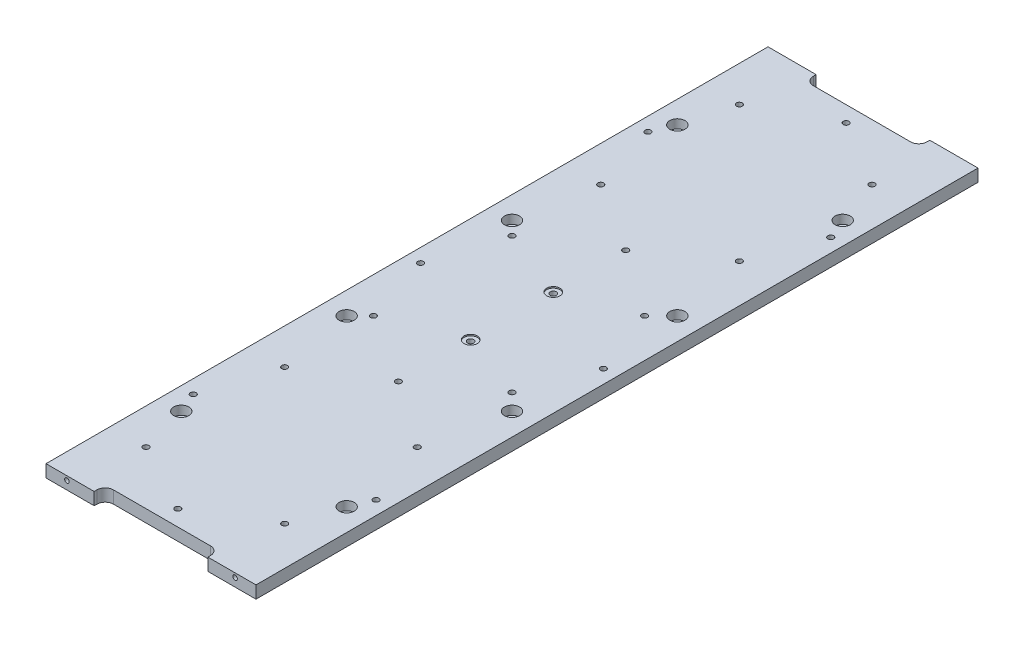
from build123d import *

# Parameters (mm, degrees)
BOSS_EXTRUDE1_DEPTH                                 = 6
CBORE_FOR_M4_HEX_SOCKET_HEAD_CAP_SCREW1_D           = 4.5
CBORE_FOR_M4_HEX_SOCKET_HEAD_CAP_SCREW1_CBORE_D     = 8
CBORE_FOR_M4_HEX_SOCKET_HEAD_CAP_SCREW1_CBORE_DEPTH = 4.4
CBORE_START                                         = 7.6
CBORE_FOR_M4_HEX_SOCKET_HEAD_CAP_SCR_2_R            = 4
CBORE_FOR_M4_HEX_SOCKET_HEAD_CAP_SCREW2_DEPTH       = 4.4
CBORE_START_2                                       = 1
CBORE_FOR_M4_HEX_SOCKET_HEAD_CAP_SCR_3_O_R          = 2.25
CBORE_FOR_M4_HEX_SOCKET_HEAD_CAP_SCR_3_DEPTH        = 6.6
SKETCH15_W                                          = 81.5
SKETCH15_H                                          = 12
BOSS_EXTRUDE2_DEPTH                                 = 2
M4_TAPPED_HOLE1_D                                   = 3.3
CUT_EXTRUDE1_DEPTH                                  = 70.296464556
CUT_EXTRUDE3_DEPTH                                  = 70.296464574
FILLET1_R                                           = 4
SKETCH16_W                                          = 20
SKETCH16_H                                          = 12
BOSS_EXTRUDE3_DEPTH                                 = 2.75
FILLET2_R                                           = 3.5
M2_TAPPED_HOLE1_D                                   = 1.6
M2_TAPPED_HOLE1_DEPTH                               = 7.2
M2_TAPPED_HOLE1_TIP                                 = 0.480688495
M3_TAPPED_HOLE1_D                                   = 2.5
BOSS_EXTRUDE4_DEPTH                                 = 9
M4_TAPPED_HOLE2_AT_2_COUNT                          = 2
M4_TAPPED_HOLE2_AT_2_PITCH                          = 122
CBORE_FOR_M6_HEX_SOCKET_HEAD_CAP_SCREW1_D           = 6.6
CBORE_FOR_M6_HEX_SOCKET_HEAD_CAP_SCREW1_CBORE_D     = 11
CBORE_FOR_M6_HEX_SOCKET_HEAD_CAP_SCREW1_CBORE_DEPTH = 6.4
SKETCH44_R                                          = 4.826
CUT_EXTRUDE6_DEPTH                                  = 1
CBORE_FOR_M4_HEX_SOCKET_HEAD_CAP_SCREW3_D           = 4.5
CBORE_FOR_M4_HEX_SOCKET_HEAD_CAP_SCREW3_CBORE_D     = 8
CBORE_FOR_M4_HEX_SOCKET_HEAD_CAP_SCREW3_CBORE_DEPTH = 4.4
M5_TAPPED_HOLE1_D                                   = 4.2


# Read off the part's stored shape, not the designer's step: CBORE for M4 Hex Socket Head Cap Screw2
with BuildPart() as part:
    # Sketch2 → Boss-Extrude1 (new, symmetric)
    with BuildSketch(Plane(origin=(0, 0, 0), x_dir=(1, 0, 0), z_dir=(0, 1, 0))):
        with BuildLine():
            Line((67, 11), (67, -10.5))
            ThreePointArc((67, -10.5), (66.560660172, -11.560660172), (65.5, -12))
            Line((65.5, -12), (-65.5, -12))
            ThreePointArc((-65.5, -12), (-66.560660172, -11.560660172), (-67, -10.5))
            Line((-67, -10.5), (-67, 11))
            Line((-67, 11), (0, 11))
            Line((0, 11), (67, 11))
        make_face()
        with BuildLine():
            Line((42.806252715, 3.5), (35.85, 3.5))
            ThreePointArc((35.85, 3.5), (34.435786438, 4.085786438), (33.85, 5.5))
            Line((33.85, 5.5), (33.85, 8.25))
            ThreePointArc((33.85, 8.25), (33.190990258, 9.840990258), (31.6, 10.5))
            Line((31.6, 10.5), (19.6, 10.5))
            ThreePointArc((19.6, 10.5), (17.35, 8.25), (19.6, 6))
            Line((19.6, 6), (27.75, 6))
            ThreePointArc((27.75, 6), (29.164213562, 5.414213562), (29.75, 4))
            Line((29.75, 4), (29.75, 1.25))
            ThreePointArc((29.75, 1.25), (30.409009742, -0.340990258), (32, -1))
            Line((32, -1), (42.062746067, -1))
            ThreePointArc((42.062746067, -1), (57.892990527, -1.304109096), (42.806252715, 3.5))
        make_face(mode=Mode.SUBTRACT)
        with BuildLine():
            Line((-42.062746067, -1), (-32, -1))
            ThreePointArc((-32, -1), (-30.409009742, -0.340990258), (-29.75, 1.25))
            Line((-29.75, 1.25), (-29.75, 4))
            ThreePointArc((-29.75, 4), (-29.164213562, 5.414213562), (-27.75, 6))
            Line((-27.75, 6), (-19.6, 6))
            ThreePointArc((-19.6, 6), (-17.35, 8.25), (-19.6, 10.5))
            Line((-19.6, 10.5), (-31.6, 10.5))
            ThreePointArc((-31.6, 10.5), (-33.190990258, 9.840990258), (-33.85, 8.25))
            Line((-33.85, 8.25), (-33.85, 5.5))
            ThreePointArc((-33.85, 5.5), (-34.435786438, 4.085786438), (-35.85, 3.5))
            Line((-35.85, 3.5), (-42.806252715, 3.5))
            ThreePointArc((-42.806252715, 3.5), (-57.892990527, -1.304109096), (-42.062746067, -1))
        make_face(mode=Mode.SUBTRACT)
    extrude(amount=BOSS_EXTRUDE1_DEPTH, both=True)

    # CBORE for M4 Hex Socket Head Cap Screw1 (through all)
    with Locations(Plane.XY.offset(12)):
        with Locations((61, 0), (-61, 0)):
            CounterBoreHole(CBORE_FOR_M4_HEX_SOCKET_HEAD_CAP_SCREW1_D / 2, CBORE_FOR_M4_HEX_SOCKET_HEAD_CAP_SCREW1_CBORE_D / 2, CBORE_FOR_M4_HEX_SOCKET_HEAD_CAP_SCREW1_CBORE_DEPTH)

    # CBORE for M4 Hex Socket Head Cap Scr 2 → CBORE for M4 Hex Socket Head Cap Screw2 (cut)
    with BuildSketch(Plane.XY.offset(CBORE_START)):
        with Locations((-38, 0)):
            Circle(CBORE_FOR_M4_HEX_SOCKET_HEAD_CAP_SCR_2_R)
        with Locations((38, 0)):
            Circle(CBORE_FOR_M4_HEX_SOCKET_HEAD_CAP_SCR_2_R)
    extrude(amount=CBORE_FOR_M4_HEX_SOCKET_HEAD_CAP_SCREW2_DEPTH, mode=Mode.SUBTRACT)

    # CBORE for M4 Hex Socket Head Cap Scr 3 o → CBORE for M4 Hex Socket Head Cap Scr 3 (cut)
    with BuildSketch(Plane.XY.offset(CBORE_START_2)):
        with Locations((-38, 0)):
            Circle(CBORE_FOR_M4_HEX_SOCKET_HEAD_CAP_SCR_3_O_R)
        with Locations((38, 0)):
            Circle(CBORE_FOR_M4_HEX_SOCKET_HEAD_CAP_SCR_3_O_R)
    extrude(amount=CBORE_FOR_M4_HEX_SOCKET_HEAD_CAP_SCR_3_DEPTH, mode=Mode.SUBTRACT)

    # Sketch15 → Boss-Extrude2 (add)
    with BuildSketch(Plane(origin=(0, 0, -11), x_dir=(-1, 0, 0), z_dir=(0, 0, -1))):
        Rectangle(SKETCH15_W, SKETCH15_H)
    extrude(amount=BOSS_EXTRUDE2_DEPTH)

    # M4 Tapped Hole1 (through all)
    with Locations(Plane.XY.offset(12)):
        with Locations((38, 0), (-38, 0)):
            Hole(M4_TAPPED_HOLE1_D / 2)

    # Sketch12 → Cut-Revolve1 (revolve, cut)
    with BuildSketch(Plane.XY, mode=Mode.PRIVATE) as cut_revolve1_sk:
        Polygon((0, -6), (6.5, -6), (6.5, -2), (5, -2), (5, 1.25), (4, 1.25), (4, 2), (6.5, 2), (6.5, 6), (0, 6), align=None)
    revolve(cut_revolve1_sk.sketch.rotate(Axis((0, 0, 0), (0, 1, 0)), 90), axis=Axis((0, 0, 0), (0, 1, 0)), mode=Mode.SUBTRACT)

    # Sketch13 → Cut-Extrude1 (cut, through all)
    with BuildSketch(Plane(origin=(0, 6, 0), x_dir=(1, 0, 0), z_dir=(0, 1, 0))):
        with BuildLine():
            Line((-30.884585901, -4), (-19.6, -4))
            ThreePointArc((-19.6, -4), (-18.009009742, -3.340990258), (-17.35, -1.75))
            Line((-17.35, -1.75), (-17.35, 8.25))
            ThreePointArc((-17.35, 8.25), (-18.009009742, 6.659009742), (-19.6, 6))
            Line((-19.6, 6), (-27.75, 6))
            ThreePointArc((-27.75, 6), (-29.164213562, 5.414213562), (-29.75, 4))
            Line((-29.75, 4), (-29.75, 1.25))
            ThreePointArc((-29.75, 1.25), (-30.409009742, -0.340990258), (-32, -1))
            Line((-32, -1), (-35.85, -1))
            ThreePointArc((-35.85, -1), (-34.582145215, -1.281076639), (-33.551866671, -2.071637171))
            Line((-33.551866671, -2.071637171), (-32.608185898, -3.196272122))
            ThreePointArc((-32.608185898, -3.196272122), (-31.83547699, -3.789192521), (-30.884585901, -4))
        make_face()
        with BuildLine():
            Line((27.75, 6), (19.6, 6))
            ThreePointArc((19.6, 6), (18.009009742, 6.659009742), (17.35, 8.25))
            Line((17.35, 8.25), (17.35, -1.75))
            ThreePointArc((17.35, -1.75), (18.009009742, -3.340990258), (19.6, -4))
            Line((19.6, -4), (30.884585901, -4))
            ThreePointArc((30.884585901, -4), (31.83547699, -3.789192521), (32.608185898, -3.196272122))
            Line((32.608185898, -3.196272122), (33.551866671, -2.071637171))
            ThreePointArc((33.551866671, -2.071637171), (34.582145215, -1.281076639), (35.85, -1))
            Line((35.85, -1), (32, -1))
            ThreePointArc((32, -1), (30.409009742, -0.340990258), (29.75, 1.25))
            Line((29.75, 1.25), (29.75, 4))
            ThreePointArc((29.75, 4), (29.164213562, 5.414213562), (27.75, 6))
        make_face()
    extrude(amount=-CUT_EXTRUDE1_DEPTH, mode=Mode.SUBTRACT)

    # Sketch20 → Cut-Extrude3 (cut, through all)
    with BuildSketch(Plane(origin=(0, 6, 0), x_dir=(1, 0, 0), z_dir=(0, 1, 0))):
        with BuildLine():
            Line((40.75, 11), (40.75, 13))
            Line((40.75, 13), (47.5, 11))
            Line((47.5, 11), (44.125, 9.051442841))
            ThreePointArc((44.125, 9.051442841), (41.875, 9.051442841), (40.75, 11))
        make_face()
        with BuildLine():
            Line((-47.5, 11), (-40.75, 13))
            Line((-40.75, 13), (-40.75, 11))
            ThreePointArc((-40.75, 11), (-41.875, 9.051442841), (-44.125, 9.051442841))
            Line((-44.125, 9.051442841), (-47.5, 11))
        make_face()
    extrude(amount=-CUT_EXTRUDE3_DEPTH, mode=Mode.SUBTRACT)

    # Fillet1
    fillet1_edges = [part.edges().sort_by_distance(p)[0] for p in [
        (47.5, 0, -11),
        (-47.5, 0, -11),
    ]]
    fillet(fillet1_edges, radius=FILLET1_R)

    # Sketch16 → Boss-Extrude3 (add)
    with BuildSketch(Plane(origin=(0, 0, -13), x_dir=(-1, 0, 0), z_dir=(0, 0, -1))):
        Rectangle(SKETCH16_W, SKETCH16_H)
    extrude(amount=BOSS_EXTRUDE3_DEPTH)

    # Fillet2
    # the kernel refuses this fillet: 3.5 mm, written as the material it adds along each edge
    with BuildSketch(Plane(origin=(-10, 6, -13), x_dir=(-1, 0, 0), z_dir=(0, -1, 0)), Plane(origin=(10, -6, -13), x_dir=(1, 0, 0), z_dir=(0, 1, 0))) as fillet2_piece_1:
        with BuildLine():
            CenterArc((3.418698583, 3.5), FILLET2_R, 192.373625116, 77.626374884)
            Line((0, 2.75), (-0.068373972, 2.735))
            ThreePointArc((-0.068373972, 2.735), (-0.07, 1.375), (-0.07, 0))
            Line((-0.07, 0), (0, -0.07))
            Line((0, -0.07), (3.418698583, -0.07))
            Line((3.418698583, -0.07), (3.418698583, 0))
        make_face()
    extrude(amount=12)

    # M2 Tapped Hole1
    with Locations(Plane(origin=(0, 0, -15.75), x_dir=(-1, 0, 0), z_dir=(0, 0, -1))):
        with Locations((4.765, 0), (-4.765, 0)):
            Hole(M2_TAPPED_HOLE1_D / 2, depth=M2_TAPPED_HOLE1_DEPTH)
            with Locations((0, 0, -(M2_TAPPED_HOLE1_DEPTH + M2_TAPPED_HOLE1_TIP / 2))):  # 118° drill point
                Cone(0, M2_TAPPED_HOLE1_D / 2, M2_TAPPED_HOLE1_TIP, mode=Mode.SUBTRACT)

    # M3 Tapped Hole1 (through all)
    with Locations(Plane(origin=(0, 6, 0), x_dir=(1, 0, 0), z_dir=(0, 1, 0))):
        with Locations((14, 0), (-14, 0)):
            Hole(M3_TAPPED_HOLE1_D / 2)


with BuildPart() as body_2:
    # Sketch26 → Boss-Extrude4 (new body)
    with BuildSketch(Plane.XZ.offset(6)):
        with BuildLine():
            Line((-76.2, -11), (-41.25, -11))
            Line((-41.25, -11), (-41.25, -13))
            ThreePointArc((-41.25, -13), (-39.492640687, -17.242640687), (-35.25, -19))
            Line((-35.25, -19), (35.25, -19))
            ThreePointArc((35.25, -19), (39.492640687, -17.242640687), (41.25, -13))
            Line((41.25, -13), (41.25, -11))
            Line((41.25, -11), (76.2, -11))
            Line((76.2, -11), (76.2, -535))
            Line((76.2, -535), (41.25, -535))
            Line((41.25, -535), (41.25, -533))
            ThreePointArc((41.25, -533), (39.492640687, -528.757359313), (35.25, -527))
            Line((35.25, -527), (-35.25, -527))
            ThreePointArc((-35.25, -527), (-39.492640687, -528.757359313), (-41.25, -533))
            Line((-41.25, -533), (-41.25, -535))
            Line((-41.25, -535), (-76.2, -535))
            Line((-76.2, -535), (-76.2, -11))
        make_face()
    extrude(amount=-BOSS_EXTRUDE4_DEPTH)

    # Sketch29 → M4 Tapped Hole2 (revolve, cut)
    with BuildSketch(Plane(origin=(-61, 0, -11), x_dir=(0, -1, 0), z_dir=(1, 0, 0))):
        Polygon((0, 0), (0, 11.091420021), (1.65, 10.1), (1.65, 0), align=None)
    m4_tapped_hole2 = revolve(axis=Axis((-61, 0, -4.65), (0, 0, -1)), mode=Mode.SUBTRACT)

    # M4 Tapped Hole2 at 2: M4 Tapped Hole2 ×2
    with Locations(*[(i * M4_TAPPED_HOLE2_AT_2_PITCH, 0, 0) for i in range(1, M4_TAPPED_HOLE2_AT_2_COUNT)]):
        add(m4_tapped_hole2, mode=Mode.SUBTRACT)

    # Mirror1: M4 Tapped Hole2 across plane
    add(m4_tapped_hole2.mirror(Plane.XY.offset(-273)), mode=Mode.SUBTRACT)

    # Mirror1 copy 1 sketch → Mirror1 copy 1 (revolve, cut)
    with BuildSketch(Plane(origin=(61, 0, -535), x_dir=(0, -1, 0), z_dir=(1, 0, 0))):
        Polygon((0, 0), (0, -11.091420021), (1.65, -10.1), (1.65, 0), align=None)
    revolve(axis=Axis((61, 0, -541.35), (0, 0, -1)), mode=Mode.SUBTRACT)

    # CBORE for M6 Hex Socket Head Cap Screw1 (through all)
    with Locations(Plane(origin=(0, 3, 0), x_dir=(-1, 0, 0), z_dir=(0, 1, 0))):
        with Locations((-60, -453), (-60, -333), (60, -333), (60, -453), (60, -93), (60, -213), (-60, -213), (-60, -93)):
            CounterBoreHole(CBORE_FOR_M6_HEX_SOCKET_HEAD_CAP_SCREW1_D / 2, CBORE_FOR_M6_HEX_SOCKET_HEAD_CAP_SCREW1_CBORE_D / 2, CBORE_FOR_M6_HEX_SOCKET_HEAD_CAP_SCREW1_CBORE_DEPTH)

    # Sketch44 → Cut-Extrude6 (cut)
    with BuildSketch(Plane.XZ.offset(-3)):
        with Locations(Location((0, -243, 0), (0, 0, 270))):
            Circle(SKETCH44_R)
        with Locations(Location((0, -303, 0), (0, 0, 270))):
            Circle(SKETCH44_R)
    extrude(amount=CUT_EXTRUDE6_DEPTH, mode=Mode.SUBTRACT)

    # CBORE for M4 Hex Socket Head Cap Screw3 (through all)
    with Locations(Plane(origin=(0, -6, 0), x_dir=(-1, 0, 0), z_dir=(0, -1, 0))):
        with Locations((0, 303), (0, 243)):
            CounterBoreHole(CBORE_FOR_M4_HEX_SOCKET_HEAD_CAP_SCREW3_D / 2, CBORE_FOR_M4_HEX_SOCKET_HEAD_CAP_SCREW3_CBORE_D / 2, CBORE_FOR_M4_HEX_SOCKET_HEAD_CAP_SCREW3_CBORE_DEPTH)

    # M5 Tapped Hole1 (through all)
    with Locations(Plane(origin=(0, 3, 0), x_dir=(1, 0, 0), z_dir=(0, 1, 0))):
        with Locations((-66.338078988, 273), (-50.297302762, 323.297302762), (48.11851323, 321.11851323), (66.337901802, 273), (48.11851323, 224.88148677), (0, 190.5), (-50.297302762, 222.702697238), (0, 355.5), (-50.297302762, 387.702697238), (-66.338078988, 438), (-50.297302762, 488.297302762), (0, 515.5), (48.11851323, 486.11851323), (66.337901802, 438), (48.11851323, 389.88148677), (-50.297302762, 57.702697238), (-66.338078988, 108), (-50.297302762, 158.297302762), (48.11851323, 156.11851323), (66.337901802, 108), (48.11851323, 59.88148677), (0, 30.5)):
            Hole(M5_TAPPED_HOLE1_D / 2)


solid = body_2.part
